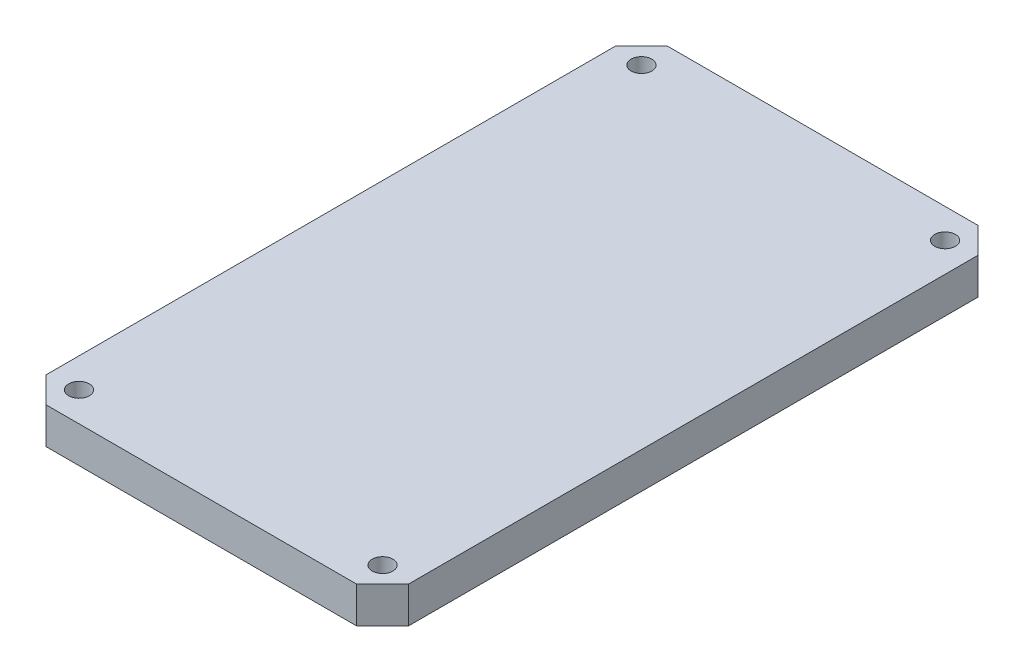
from build123d import *

# Parameters (mm, degrees)
SKETCH2_R           = 2.54
BOSS_EXTRUDE1_DEPTH = 2.54
BOSS_EXTRUDE2_START = -6.35
SKETCH2_3_R         = 2.54
BOSS_EXTRUDE2_DEPTH = 6.35
BOSS_EXTRUDE3_START = -2.54
BOSS_EXTRUDE3_DEPTH = 1.6


with BuildPart() as part:
    # Sketch2 → Boss-Extrude1 (new body)
    with BuildSketch(Plane(origin=(0, 0, 0), x_dir=(1, 0, 0), z_dir=(0, 1, 0))):
        Polygon((-44.45, 69.85), (-38.1, 76.2), (38.1, 76.2), (44.45, 69.85), (44.45, -69.85), (38.1, -76.2), (-38.1, -76.2), (-44.45, -69.85), align=None)
        with Locations(Location((-37.233884746, 68.983884746, 0), (0, 0, 270))):
            Circle(SKETCH2_R, mode=Mode.SUBTRACT)
        with Locations(Location((37.233884746, 68.983884746, 0), (0, 0, 270))):
            Circle(SKETCH2_R, mode=Mode.SUBTRACT)
        with Locations(Location((37.233884746, -68.983884746, 0), (0, 0, 270))):
            Circle(SKETCH2_R, mode=Mode.SUBTRACT)
        with Locations(Location((-37.233884746, -68.983884746, 0), (0, 0, 270))):
            Circle(SKETCH2_R, mode=Mode.SUBTRACT)
    extrude(amount=BOSS_EXTRUDE1_DEPTH)

    # Sketch2<3> → Boss-Extrude2 (add)
    with BuildSketch(Plane(origin=(0, 0, 0), x_dir=(1, 0, 0), z_dir=(0, 1, 0)).offset(BOSS_EXTRUDE2_START)):
        Polygon((-38.1, 76.2), (-44.45, 69.85), (-44.45, -69.85), (-38.1, -76.2), (38.1, -76.2), (44.45, -69.85), (44.45, 69.85), (38.1, 76.2), align=None)
        with BuildLine():
            Line((40.64, 63.408074469), (40.64, -63.408074469))
            ThreePointArc((40.64, -63.408074469), (40.089682627, -64.454476359), (38.9156584, -64.594022912))
            ThreePointArc((38.9156584, -64.594022912), (33.909787158, -65.659787158), (32.844022912, -70.6656584))
            ThreePointArc((32.844022912, -70.6656584), (32.704476359, -71.839682627), (31.658074469, -72.39))
            Line((31.658074469, -72.39), (-31.658074469, -72.39))
            ThreePointArc((-31.658074469, -72.39), (-32.704476359, -71.839682627), (-32.844022912, -70.6656584))
            ThreePointArc((-32.844022912, -70.6656584), (-33.909787158, -65.659787158), (-38.9156584, -64.594022912))
            ThreePointArc((-38.9156584, -64.594022912), (-40.089682627, -64.454476359), (-40.64, -63.408074469))
            Line((-40.64, -63.408074469), (-40.64, 63.408074469))
            ThreePointArc((-40.64, 63.408074469), (-40.089682627, 64.454476359), (-38.9156584, 64.594022912))
            ThreePointArc((-38.9156584, 64.594022912), (-33.909787158, 65.659787158), (-32.844022912, 70.6656584))
            ThreePointArc((-32.844022912, 70.6656584), (-32.704476359, 71.839682627), (-31.658074469, 72.39))
            Line((-31.658074469, 72.39), (31.658074469, 72.39))
            ThreePointArc((31.658074469, 72.39), (32.704476359, 71.839682627), (32.844022912, 70.6656584))
            ThreePointArc((32.844022912, 70.6656584), (33.909787158, 65.659787158), (38.9156584, 64.594022912))
            ThreePointArc((38.9156584, 64.594022912), (40.089682627, 64.454476359), (40.64, 63.408074469))
        make_face(mode=Mode.SUBTRACT)
        with Locations(Location((-37.233884746, 68.983884746, 0), (0, 0, 270))):
            Circle(SKETCH2_3_R, mode=Mode.SUBTRACT)
        with Locations(Location((37.233884746, 68.983884746, 0), (0, 0, 270))):
            Circle(SKETCH2_3_R, mode=Mode.SUBTRACT)
        with Locations(Location((-37.233884746, -68.983884746, 0), (0, 0, 270))):
            Circle(SKETCH2_3_R, mode=Mode.SUBTRACT)
        with Locations(Location((37.233884746, -68.983884746, 0), (0, 0, 270))):
            Circle(SKETCH2_3_R, mode=Mode.SUBTRACT)
    extrude(amount=BOSS_EXTRUDE2_DEPTH)


with BuildPart() as body_2:
    # Sketch2<4> → Boss-Extrude3 (new body)
    with BuildSketch(Plane(origin=(0, 0, 0), x_dir=(1, 0, 0), z_dir=(0, 1, 0)).offset(BOSS_EXTRUDE3_START)):
        with BuildLine():
            ThreePointArc((-40.64, 63.408074469), (-40.089682627, 64.454476359), (-38.9156584, 64.594022912))
            ThreePointArc((-38.9156584, 64.594022912), (-33.909787158, 65.659787158), (-32.844022912, 70.6656584))
            ThreePointArc((-32.844022912, 70.6656584), (-32.704476359, 71.839682627), (-31.658074469, 72.39))
            Line((-31.658074469, 72.39), (31.658074469, 72.39))
            ThreePointArc((31.658074469, 72.39), (32.704476359, 71.839682627), (32.844022912, 70.6656584))
            ThreePointArc((32.844022912, 70.6656584), (33.909787158, 65.659787158), (38.9156584, 64.594022912))
            ThreePointArc((38.9156584, 64.594022912), (40.089682627, 64.454476359), (40.64, 63.408074469))
            Line((40.64, 63.408074469), (40.64, -63.408074469))
            ThreePointArc((40.64, -63.408074469), (40.089682627, -64.454476359), (38.9156584, -64.594022912))
            ThreePointArc((38.9156584, -64.594022912), (33.909787158, -65.659787158), (32.844022912, -70.6656584))
            ThreePointArc((32.844022912, -70.6656584), (32.704476359, -71.839682627), (31.658074469, -72.39))
            Line((31.658074469, -72.39), (-31.658074469, -72.39))
            ThreePointArc((-31.658074469, -72.39), (-32.704476359, -71.839682627), (-32.844022912, -70.6656584))
            ThreePointArc((-32.844022912, -70.6656584), (-33.909787158, -65.659787158), (-38.9156584, -64.594022912))
            ThreePointArc((-38.9156584, -64.594022912), (-40.089682627, -64.454476359), (-40.64, -63.408074469))
            Line((-40.64, -63.408074469), (-40.64, 63.408074469))
        make_face()
    extrude(amount=-BOSS_EXTRUDE3_DEPTH)


solid = Compound([part.part, body_2.part])
